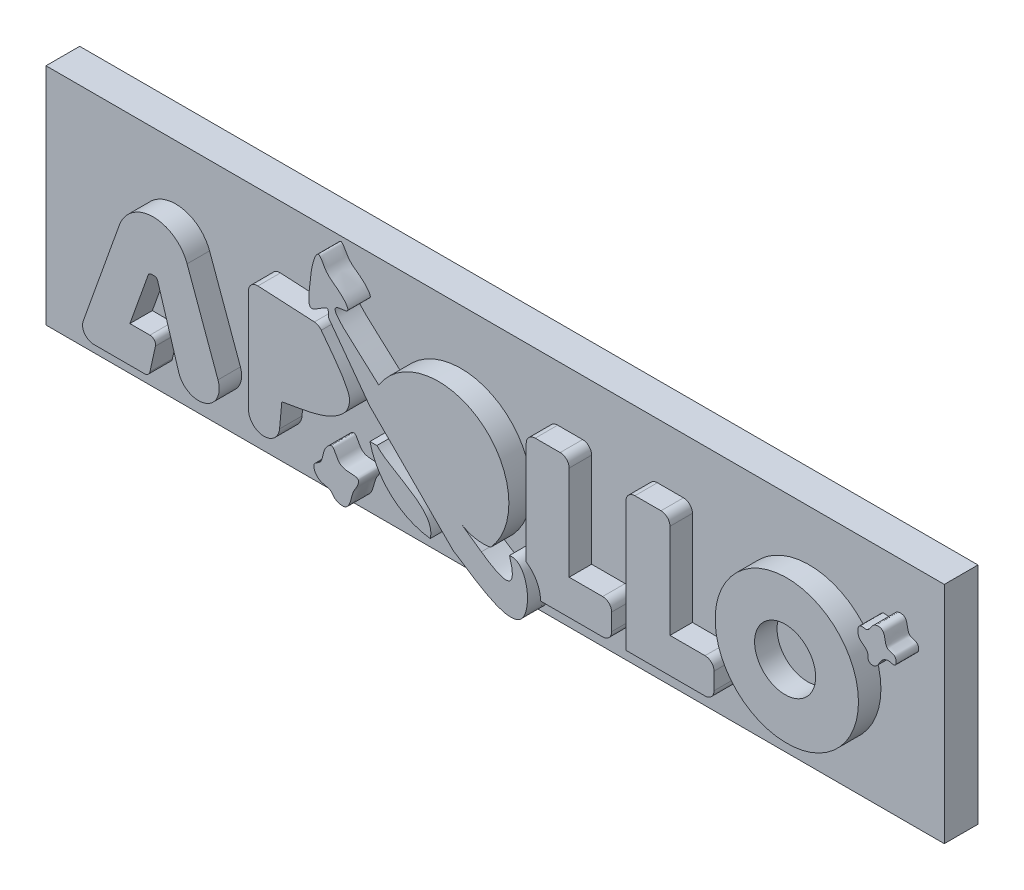
from build123d import *

# Parameters (mm, degrees)
SKETCH1_W           = 80
SKETCH1_H           = 20
BOSS_EXTRUDE1_DEPTH = 3
SKETCH2_R           = 6.380976216
SKETCH2_R_2         = 2.719199248
BOSS_EXTRUDE2_DEPTH = 2
FILLET2_R           = 3.205073
FILLET3_R           = 1
FILLET4_R           = 0.5
FILLET5_R           = 0.3
FILLET6_R           = 1.841599
FILLET7_R           = 1.386507
FILLET8_R           = 0.8
FILLET9_R           = 0.8


with BuildPart() as part:
    # Sketch1 → Boss-Extrude1 (new body)
    with BuildSketch(Plane.XY):
        Rectangle(SKETCH1_W, SKETCH1_H)
    extrude(amount=BOSS_EXTRUDE1_DEPTH)

    # Sketch2 → Boss-Extrude2 (add)
    # profile 1 of 9: a face of its own
    with BuildSketch(Plane.XY.offset(3)):
        Polygon((-28.12386187, -4.1509041), (-28.827784411, -7.366226909), (-35.163087278, -7.366226909), (-30.704911186, 5.116666146), (-26.199806926, 5.116666146), (-21.788559004, -7.03813971), (-25.777453401, -7.03813971), (-28.12386187, 0.611561886), (-28.827784411, 0.611561886), (-30.52866512, -4.1509041), align=None)
    # profile 2 of 9: a face of its own
    with BuildSketch(Plane.XY.offset(3)):
        with BuildLine():
            add(Edge.make_bspline(
                [(-12.59251829, -4.602818179), (-12.285673118, -4.594098223), (-12.045189517, -6.278366622), (-9.871466908, -5.586592295), (-10.310467369, -6.670441484), (-10.854905139, -7.382635244), (-10.830670227, -9.028744868), (-12.281022713, -8.653920913), (-12.716621389, -7.864668819), (-13.768754433, -8.064018209), (-14.380398238, -6.747801361), (-13.293676747, -6.35036102), (-13.459858592, -5.340760333), (-12.767881366, -4.607801664), (-12.59251829, -4.602818179)],
                knots=[0, 0, 0, 0, 0.11011461, 0.24548725, 0.297531876, 0.3293896, 0.480571745, 0.567582488, 0.595866624, 0.693752282, 0.782283129, 0.818820639, 0.93706912, 1, 1, 1, 1], degree=3))
        make_face()
    # profile 3 of 9: a face of its own
    with BuildSketch(Plane.XY.offset(3)):
        with BuildLine():
            add(Edge.make_bspline(
                [(-8.364983843, 2.187446392), (-8.942555715, 2.722192331), (-10.361072154, 4.001436937), (-13.176484219, 6.470073101), (-10.670110511, 6.353529328), (-12.070158555, 7.96822111), (-12.990019942, 8.246638508), (-13.819017978, 10.213670234), (-14.41914197, 8.105522509), (-14.425611396, 7.044369894), (-14.969993178, 4.05299408), (-12.667604996, 6.407674494), (-12.895281858, 5.275383081), (-12.817237262, 5.116666146)],
                knots=[0.503915921, 0.503915921, 0.503915921, 0.503915921, 0.576098582, 0.651465373, 0.677045264, 0.71058421, 0.764881215, 0.792947692, 0.837231417, 0.870050202, 0.926523616, 0.970559616, 0.988496237, 0.988496237, 0.988496237, 0.988496237], degree=3))
            Line((-12.817237262, 5.116666146), (-12.777720238, 5.063065635))
            Line((-12.777720238, 5.063065635), (-9.177050203, 0.179151487))
            Line((-9.177050203, 0.179151487), (-1.736347016, -7.261551699))
            add(Edge.make_bspline(
                [(-1.736347016, -7.261551699), (-0.728975006, -7.80212022), (5.830498878, -13.19071187), (4.93019751, -4.880525107), (3.278062555, -5.129908048)],
                knots=[0, 0, 0, 0, 0.585486137, 1, 1, 1, 1], degree=3))
            add(Edge.make_bspline(
                [(3.278062555, -5.129908048), (4.158720522, -8.005473341), (2.569289754, -7.373472742), (0.770825638, -6.103511786)],
                knots=[0, 0, 0, 0, 0.147053008, 0.147053008, 0.147053008, 0.147053008], degree=3))
            Line((0.770825638, -6.103511786), (-0.948997568, -4.889082039))
            add(Edge.make_bspline(
                [(-0.948997568, -4.889082039), (0.258992445, -5.583100773), (1.603924753, -5.334615685)],
                knots=[0, 0, 0, 1, 1, 1], degree=2))
            ThreePointArc((1.603924753, -5.334615685), (0.728991597, 3.872719866), (-8.364983843, 2.187446392))
        make_face()
    # profile 4 of 9: a face of its own
    with BuildSketch(Plane.XY.offset(3)):
        with BuildLine():
            Line((-8.531204956, -2.555079698), (-9.151731972, -2.555079698))
            ThreePointArc((-9.151731972, -2.555079698), (-7.224495952, -5.805083304), (-3.779495461, -7.357092883))
            add(Edge.make_bspline(
                [(-8.531204956, -2.555079698), (-7.114887373, -4.034404827), (-3.248622845, -5.020262143), (-3.779495461, -7.357092883)],
                knots=[0, 0, 0, 0, 1, 1, 1, 1], degree=3))
        make_face()
    # profile 5 of 9: a face of its own
    with BuildSketch(Plane.XY.offset(3)):
        with BuildLine():
            ThreePointArc((6.041815598, -7.261551699), (5.703127314, -5.915071109), (4.767677603, -4.889082039))
            Line((4.767677603, -4.889082039), (4.767677603, 5.063065635))
            Line((4.767677603, 5.063065635), (8.59009159, 5.063065635))
            Line((8.59009159, 5.063065635), (8.59009159, -4.1509041))
            Line((8.59009159, -4.1509041), (12.372688764, -4.1509041))
            Line((12.372688764, -4.1509041), (12.372688764, -7.261551699))
            Line((12.372688764, -7.261551699), (6.041815598, -7.261551699))
        make_face()
    # profile 6 of 9: a face of its own
    with BuildSketch(Plane.XY.offset(3)):
        Polygon((17.568782778, -4.1509041), (17.568782778, 5.063065635), (13.64682676, 5.063065635), (13.64682676, -7.261551699), (21.490738796, -7.261551699), (21.490738796, -4.1509041), align=None)
    # profile 7 of 9: a face of its own
    with BuildSketch(Plane.XY.offset(3)):
        with Locations((27.973462337, -0.888700555)):
            Circle(SKETCH2_R)
        with Locations((27.821233276, -0.876256564)):
            Circle(SKETCH2_R_2, mode=Mode.SUBTRACT)
    # profile 8 of 9: a face of its own
    with BuildSketch(Plane.XY.offset(3)):
        with BuildLine():
            Line((-17.000586742, -3.411591454), (-17.330272947, -7.03813971))
            Line((-17.330272947, -7.03813971), (-19.967762587, -6.708453505))
            Line((-19.967762587, -6.708453505), (-19.967762587, 4.500877466))
            Line((-19.967762587, 4.500877466), (-13.703724691, 4.171191261))
            add(Edge.make_bspline(
                [(-13.703724691, 4.171191261), (-12.824561478, 2.852446441), (-11.669698372, 1.680510579), (-11.066235051, 0.214956801), (-10.852878548, -0.303194706), (-11.023639134, -1.014656837), (-11.395921256, -1.433474224), (-12.71333174, -2.915561019), (-15.318512758, -3.075176657), (-17.000586742, -3.411591454)],
                knots=[0, 0, 0, 0, 1, 1, 1, 2, 2, 2, 3, 3, 3, 3], degree=3))
        make_face()
    # profile 9 of 9: a face of its own
    with BuildSketch(Plane.XY.offset(3)):
        with BuildLine():
            add(Edge.make_bspline(
                [(36.457383917, 5.732763434), (36.795423659, 5.475951838), (36.55579759, 4.330823098), (37.774964362, 4.408966936), (37.724960467, 3.396819601), (37.0344127, 3.711130005), (36.269286065, 3.416552073), (36.019473408, 2.424932444), (35.120821531, 2.663677009), (35.345500165, 3.60541314), (34.182677931, 3.834525293), (34.296799972, 5.274533429), (35.314723498, 4.867381557), (35.539622469, 5.871425979), (36.278324862, 5.868796084), (36.457383917, 5.732763434)],
                knots=[0, 0, 0, 0, 0.129710503, 0.201372884, 0.260823907, 0.302302053, 0.374726038, 0.48165877, 0.525113161, 0.580837288, 0.697414792, 0.785033766, 0.839999706, 0.931292575, 1, 1, 1, 1], degree=3))
        make_face()
    extrude(amount=BOSS_EXTRUDE2_DEPTH)

    # Fillet2
    fillet2_edges = [part.edges().sort_by_distance(p)[0] for p in [
        (-26.199806926, 5.116666146, 4),
        (-30.704911186, 5.116666146, 4),
    ]]
    fillet(fillet2_edges, radius=FILLET2_R - 0.0001)  # a hair under: the kernel refuses the full size

    # Fillet3
    fillet3_edges = [part.edges().sort_by_distance(p)[0] for p in [
        (-35.163087278, -7.366226909, 4),
    ]]
    fillet(fillet3_edges, radius=FILLET3_R)

    # Fillet4
    fillet4_edges = [part.edges().sort_by_distance(p)[0] for p in [
        (-28.827784411, -7.366226909, 4),
        (-28.12386187, -4.1509041, 4),
    ]]
    fillet(fillet4_edges, radius=FILLET4_R)

    # Fillet5
    fillet5_edges = [part.edges().sort_by_distance(p)[0] for p in [
        (-28.827784411, 0.611561886, 4),
        (-28.12386187, 0.611561886, 4),
    ]]
    fillet(fillet5_edges, radius=FILLET5_R)

    # Fillet6
    fillet6_edges = [part.edges().sort_by_distance(p)[0] for p in [
        (-25.777453401, -7.03813971, 4),
        (-21.788559004, -7.03813971, 4),
    ]]
    fillet(fillet6_edges, radius=FILLET6_R)

    # Fillet7
    fillet7_edges = [part.edges().sort_by_distance(p)[0] for p in [
        (-19.967762587, -6.708453505, 4),
        (-17.330272947, -7.03813971, 4),
    ]]
    fillet(fillet7_edges, radius=FILLET7_R)

    # Fillet8
    fillet8_edges = [part.edges().sort_by_distance(p)[0] for p in [
        (-19.967762587, 4.500877466, 4),
        (-13.703724691, 4.171191261, 4),
    ]]
    fillet(fillet8_edges, radius=FILLET8_R)

    # Fillet9
    fillet9_edges = [part.edges().sort_by_distance(p)[0] for p in [
        (12.372688764, -7.261551699, 4),
        (12.372688764, -4.1509041, 4),
        (8.59009159, 5.063065635, 4),
        (4.767677603, 5.063065635, 4),
        (17.568782778, 5.063065635, 4),
        (13.64682676, 5.063065635, 4),
        (21.490738796, -7.261551699, 4),
        (21.490738796, -4.1509041, 4),
    ]]
    fillet(fillet9_edges, radius=FILLET9_R)


solid = part.part
